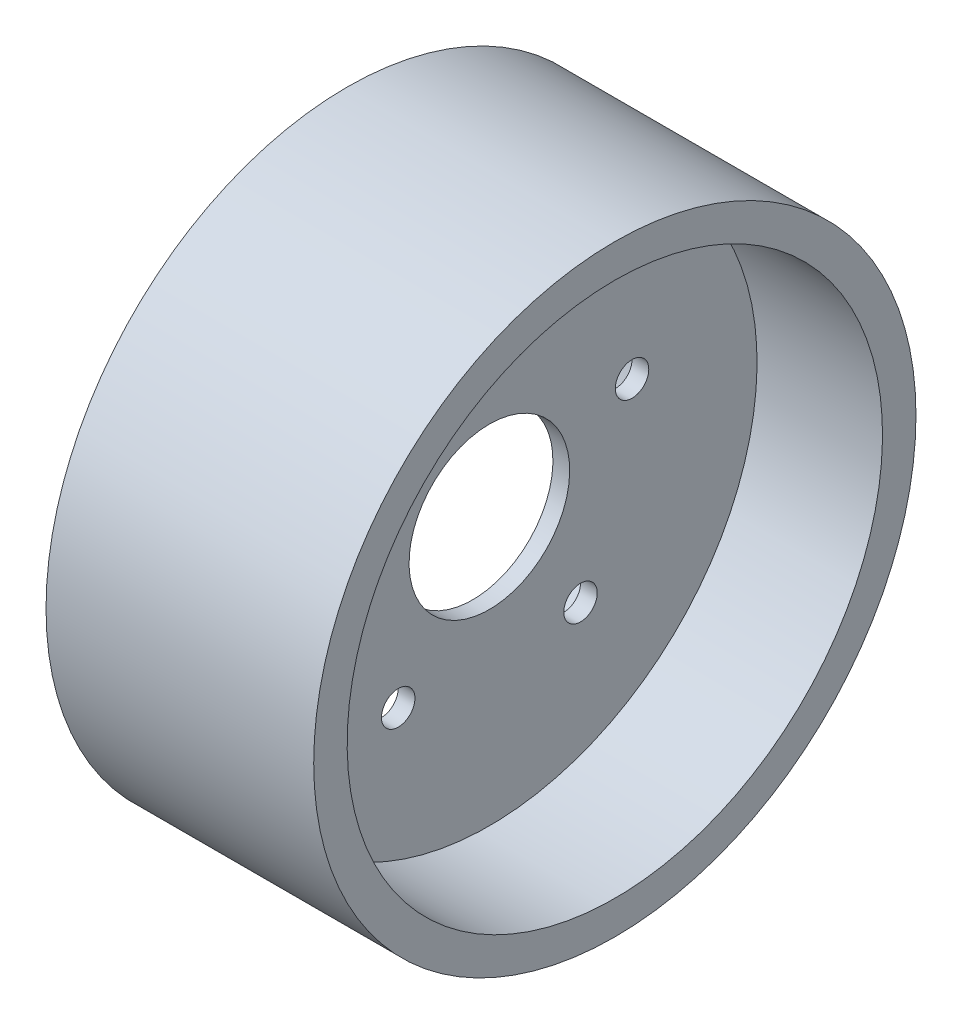
from build123d import *

# Parameters (mm, degrees)
SKETCH2_R                  = 30.48
CUT_EXTRUDE2_DEPTH         = 171.417958634
F_1_2_0_5_DIAMETER_HOLE2_D = 12.7


with BuildPart() as part:
    # Sketch1 → Revolve1 (revolve)
    with BuildSketch(Plane.XY):
        Polygon((0, 101.6), (0, 0), (6.35, 0), (6.35, 101.6), (53.975, 101.6), (53.975, 114.3), (-47.625, 114.3), (-47.625, 101.6), align=None)
    revolve(axis=Axis((6.35, 0, 0), (-1, 0, 0)))

    # Sketch2 → Cut-Extrude2 (cut, through all)
    with BuildSketch(Plane(origin=(6.35, 0, 0), x_dir=(0, 0, -1), z_dir=(1, 0, 0))):
        Circle(SKETCH2_R)
    extrude(amount=-CUT_EXTRUDE2_DEPTH, mode=Mode.SUBTRACT)

    # 1/2 (0.5) Diameter Hole2 (through all)
    with Locations(Plane(origin=(6.35, 0, 0), x_dir=(0, 0, -1), z_dir=(1, 0, 0))):
        with Locations((-54.155626078, 18.25625), (0, 57.15), (54.155626078, 18.25625), (34.599427772, -45.486284722), (-34.599427772, -45.486284722)):
            Hole(F_1_2_0_5_DIAMETER_HOLE2_D / 2)


solid = part.part
